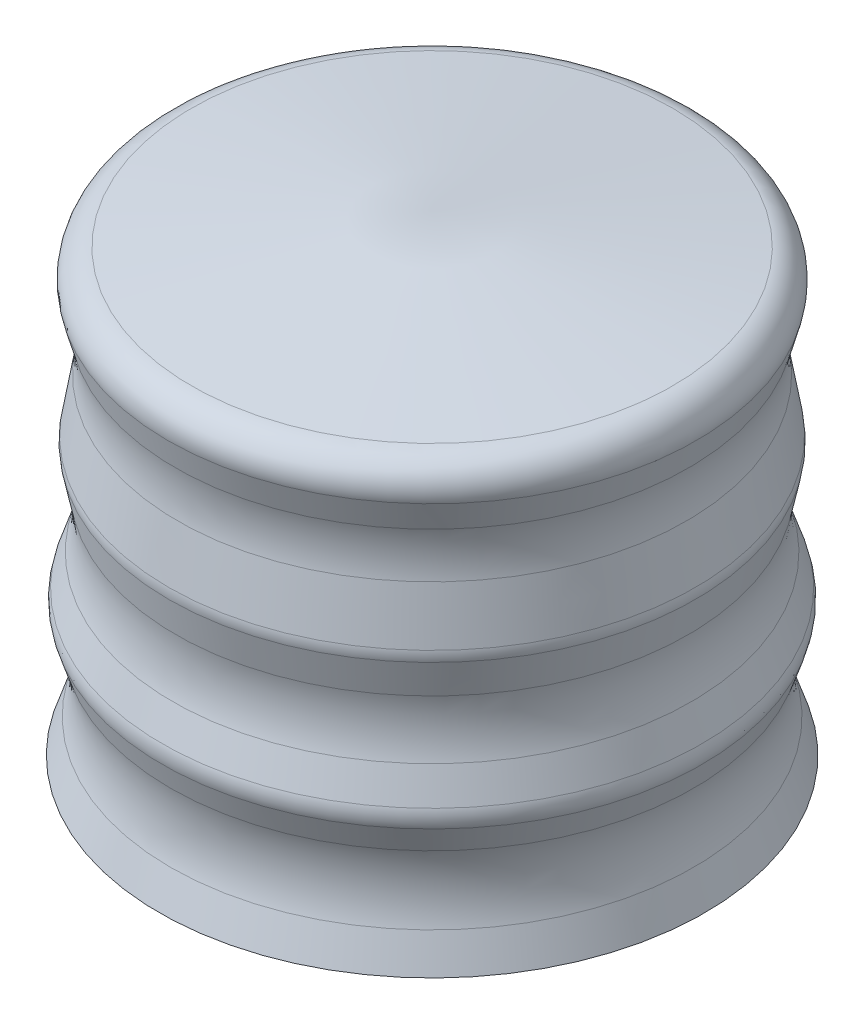
from build123d import *

# Parameters (mm, degrees)
BOSS_EXTRUDE1_DEPTH = 0.25
CIRPATTERN14_COUNT  = 4
FILLET6_R           = 0.25


with BuildPart() as part:
    # Sketch1 → Revolve1 (revolve)
    with BuildSketch(Plane(origin=(0, 0, 0), x_dir=(0, 0, -1), z_dir=(1, 0, 0))):
        with BuildLine():
            Line((0, 0), (4.82, 0))
            Line((4.82, 0), (4.621647905, 0.595056284))
            ThreePointArc((4.621647905, 0.595056284), (4.523479055, 1.2), (4.621647905, 1.804943716))
            Line((4.621647905, 1.804943716), (4.767295372, 2.241886117))
            ThreePointArc((4.767295372, 2.241886117), (4.792953723, 2.4), (4.767295372, 2.558113883))
            Line((4.767295372, 2.558113883), (4.583244679, 3.110265964))
            ThreePointArc((4.583244679, 3.110265964), (4.488312315, 3.603978735), (4.525286285, 4.105374168))
            Line((4.525286285, 4.105374168), (4.650592292, 4.706843002))
            ThreePointArc((4.650592292, 4.706843002), (4.661027001, 4.800155518), (4.65383214, 4.893773587))
            Line((4.65383214, 4.893773587), (4.49266685, 5.828532271))
            ThreePointArc((4.49266685, 5.828532271), (4.467168445, 6.247676675), (4.533734173, 6.662286376))
            Line((4.533734173, 6.662286376), (4.667251519, 7.146286758))
            ThreePointArc((4.667251519, 7.146286758), (4.602010568, 7.555502903), (4.250518306, 7.774973687))
            Line((4.250518306, 7.774973687), (0, 8.334565038))
            Line((0, 8.334565038), (0, 0))
        make_face()
    revolve(axis=Axis((0, 0, 0), (0, 1, 0)))

    # Sketch3 → Boss-Extrude1 (add)
    with BuildSketch(Plane.XZ):
        with BuildLine():
            Line((1.55, 0.25), (3.05, 0.25))
            ThreePointArc((3.05, 0.25), (3.3, 0), (3.05, -0.25))
            Line((3.05, -0.25), (1.55, -0.25))
            ThreePointArc((1.55, -0.25), (1.3, 0), (1.55, 0.25))
        make_face()
    boss_extrude1 = extrude(amount=BOSS_EXTRUDE1_DEPTH)

    # CirPattern14: Boss-Extrude1 ×4 about axis
    cirpattern14_axis = Axis((0, 0, 0), (0, 1, 0))
    for i in range(1, CIRPATTERN14_COUNT):
        add(boss_extrude1.rotate(cirpattern14_axis, i * 360 / CIRPATTERN14_COUNT))

    # Fillet6
    fillet6_edges = [part.edges().sort_by_distance(p)[0] for p in [
        (-2.3, -0.25, -0.25),
        (-3.3, -0.25, 0),
        (-2.3, -0.25, 0.25),
        (-1.3, -0.25, 0),
        (0.25, -0.25, -2.3),
        (0, -0.25, -3.3),
        (-0.25, -0.25, -2.3),
        (0, -0.25, -1.3),
        (2.3, -0.25, 0.25),
        (3.3, -0.25, 0),
        (2.3, -0.25, -0.25),
        (1.3, -0.25, 0),
        (-0.25, -0.25, 2.3),
        (0, -0.25, 3.3),
        (0.25, -0.25, 2.3),
        (0, -0.25, 1.3),
    ]]
    fillet(fillet6_edges, radius=FILLET6_R - 0.0001)  # a hair under: the kernel refuses the full size


solid = part.part
